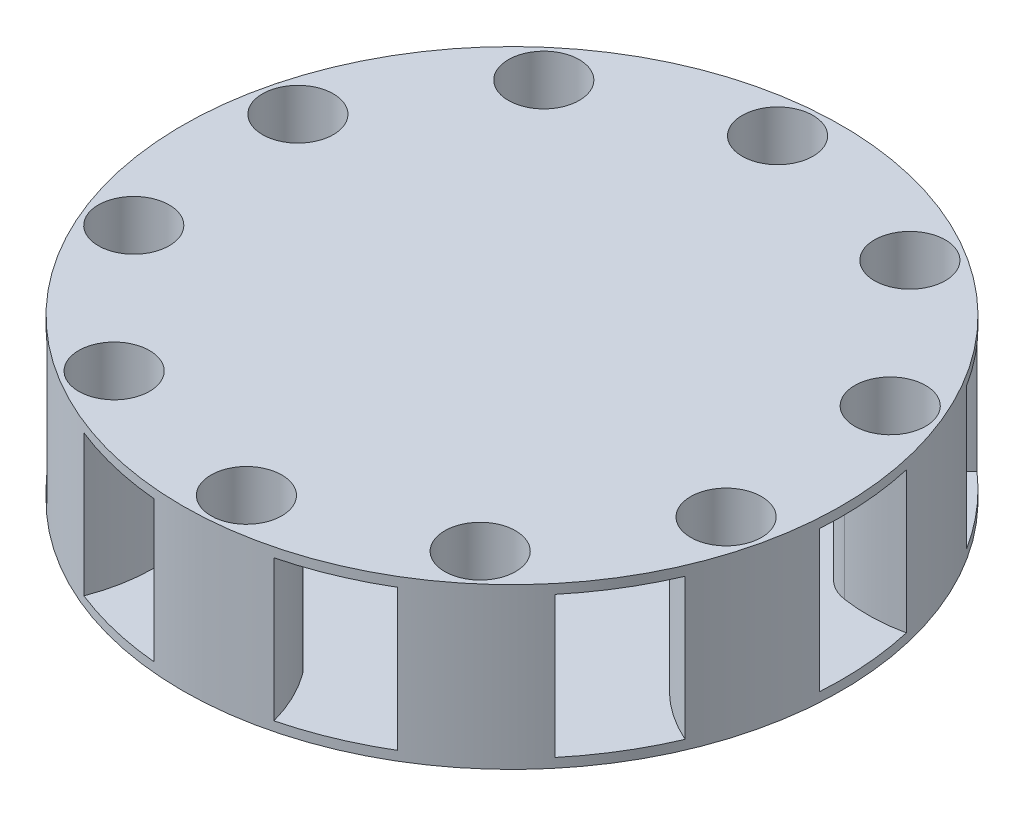
from build123d import *
from build123d.topology import SkipClean

# Parameters (mm, degrees)
SKETCH1_R           = 70
BOSS_EXTRUDE1_DEPTH = 2
SKETCH2_R           = 7.525
CUT_EXTRUDE1_DEPTH  = 2
SKETCH3_R           = 7.525
BOSS_EXTRUDE3_DEPTH = 32
SKETCH4_R           = 70
BOSS_EXTRUDE4_DEPTH = 2


with BuildPart() as part:
    # Sketch1 → Boss-Extrude1 (new body)
    with BuildSketch(Plane(origin=(0, 0, 0), x_dir=(1, 0, 0), z_dir=(0, 1, 0))):
        Circle(SKETCH1_R)
    extrude(amount=-BOSS_EXTRUDE1_DEPTH)

    # Sketch2 → Cut-Extrude1 (cut)
    with BuildSketch(Plane(origin=(0, 0, 0), x_dir=(1, 0, 0), z_dir=(0, 1, 0))):
        with Locations((-56.77852978, -23.566378191)):
            Circle(SKETCH2_R)
        with Locations((-59.786765058, 14.307982)):
            Circle(SKETCH2_R)
        with Locations((-39.958488161, 46.717179376)):
            Circle(SKETCH2_R)
        with Locations((-4.867426926, 61.28200209)):
            Circle(SKETCH2_R)
        with Locations((32.082825957, 52.439182904)):
            Circle(SKETCH2_R)
        with Locations((56.77852978, 23.566378191)):
            Circle(SKETCH2_R)
        with Locations((59.786765058, -14.307982)):
            Circle(SKETCH2_R)
        with Locations((39.958488161, -46.717179376)):
            Circle(SKETCH2_R)
        with Locations((4.867426926, -61.28200209)):
            Circle(SKETCH2_R)
        with Locations((-32.082825957, -52.439182904)):
            Circle(SKETCH2_R)
    extrude(amount=-CUT_EXTRUDE1_DEPTH, mode=Mode.SUBTRACT)

    # Sketch3 → Boss-Extrude3 (add)
    # profile 1 of 10: a face of its own
    with BuildSketch(Plane(origin=(0, 0, 0), x_dir=(1, 0, 0), z_dir=(0, 1, 0))):
        with BuildLine():
            ThreePointArc((-53.839060138, 44.73651309), (-48.521333413, 41.173599259), (-42.648435641, 38.627691904))
            ThreePointArc((-42.648435641, 38.627691904), (-34.417274471, 40.238709199), (-31.549808841, 48.120652599))
            ThreePointArc((-31.549808841, 48.120652599), (-33.15457894, 54.317206918), (-35.850120348, 60.122947957))
            ThreePointArc((-35.850120348, 60.122947957), (-45.499701851, 53.195649554), (-53.839060138, 44.73651309))
        make_face()
        with Locations((-39.958488161, 46.717179376)):
            Circle(SKETCH3_R, mode=Mode.SUBTRACT)
    # profile 2 of 10: a face of its own
    with BuildSketch(Plane(origin=(0, 0, 0), x_dir=(1, 0, 0), z_dir=(0, 1, 0))):
        with BuildLine():
            ThreePointArc((-53.80894145, 20.385913384), (-58.749470976, 24.455770937), (-64.342738745, 27.568314616))
            ThreePointArc((-64.342738745, 27.568314616), (-68.07765033, 16.292130784), (-69.852177246, 4.546793813))
            ThreePointArc((-69.852177246, 4.546793813), (-63.455817749, 4.790017318), (-57.208096848, 6.182337701))
            ThreePointArc((-57.208096848, 6.182337701), (-51.495879786, 12.323833215), (-53.80894145, 20.385913384))
        make_face()
        with Locations((-59.786765058, 14.307982)):
            Circle(SKETCH3_R, mode=Mode.SUBTRACT)
    # profile 3 of 10: a face of its own
    with BuildSketch(Plane(origin=(0, 0, 0), x_dir=(1, 0, 0), z_dir=(0, 1, 0))):
        with BuildLine():
            ThreePointArc((6.336025522, 69.712658683), (-5.542413742, 69.780238248), (-17.261251979, 67.838404905))
            ThreePointArc((-17.261251979, 67.838404905), (-15.053348893, 61.830265721), (-11.798521586, 56.318580707))
            ThreePointArc((-11.798521586, 56.318580707), (-4.192440109, 52.783765932), (2.760278407, 57.474938083))
            ThreePointArc((2.760278407, 57.474938083), (5.104235368, 63.431316031), (6.336025522, 69.712658683))
        make_face()
        with Locations((-4.867426926, 61.28200209)):
            Circle(SKETCH3_R, mode=Mode.SUBTRACT)
    # profile 4 of 10: a face of its own
    with BuildSketch(Plane(origin=(0, 0, 0), x_dir=(1, 0, 0), z_dir=(0, 1, 0))):
        with BuildLine():
            ThreePointArc((-55.514887324, -15.135551852), (-61.90406192, -14.746938322), (-68.258617871, -15.516477896))
            ThreePointArc((-68.258617871, -15.516477896), (-64.652250258, -26.834428196), (-59.184136835, -37.379646161))
            ThreePointArc((-59.184136835, -37.379646161), (-54.152336488, -33.423188431), (-49.916209492, -28.624459374))
            ThreePointArc((-49.916209492, -28.624459374), (-48.904809302, -20.298328185), (-55.514887324, -15.135551852))
        make_face()
        with Locations((-56.77852978, -23.566378191)):
            Circle(SKETCH3_R, mode=Mode.SUBTRACT)
    # profile 5 of 10: a face of its own
    with BuildSketch(Plane(origin=(0, 0, 0), x_dir=(1, 0, 0), z_dir=(0, 1, 0))):
        with BuildLine():
            ThreePointArc((46.102024996, 52.674503237), (36.531888036, 59.711147674), (25.909767747, 65.028331789))
            ThreePointArc((25.909767747, 65.028331789), (24.16450326, 58.869872212), (23.558026699, 52.497685879))
            ThreePointArc((23.558026699, 52.497685879), (27.633763879, 45.167218133), (36.016033123, 44.87575072))
            ThreePointArc((36.016033123, 44.87575072), (41.413405253, 48.316818371), (46.102024996, 52.674503237))
        make_face()
        with Locations((32.082825957, 52.439182904)):
            Circle(SKETCH3_R, mode=Mode.SUBTRACT)
    # profile 6 of 10: a face of its own
    with BuildSketch(Plane(origin=(0, 0, 0), x_dir=(1, 0, 0), z_dir=(0, 1, 0))):
        with BuildLine():
            ThreePointArc((-36.016033123, -44.87575072), (-41.413405253, -48.316818371), (-46.102024996, -52.674503237))
            ThreePointArc((-46.102024996, -52.674503237), (-36.531888036, -59.711147674), (-25.909767747, -65.028331789))
            ThreePointArc((-25.909767747, -65.028331789), (-24.16450326, -58.869872212), (-23.558026699, -52.497685878))
            ThreePointArc((-23.558026699, -52.497685878), (-27.633763879, -45.167218133), (-36.016033123, -44.87575072))
        make_face()
        with Locations((-32.082825957, -52.439182904)):
            Circle(SKETCH3_R, mode=Mode.SUBTRACT)
    # profile 7 of 10: a face of its own
    with BuildSketch(Plane(origin=(0, 0, 0), x_dir=(1, 0, 0), z_dir=(0, 1, 0))):
        with BuildLine():
            ThreePointArc((68.258617871, 15.516477896), (64.652250258, 26.834428196), (59.184136835, 37.379646161))
            ThreePointArc((59.184136835, 37.379646161), (54.152336489, 33.423188431), (49.916209492, 28.624459375))
            ThreePointArc((49.916209492, 28.624459375), (48.904809302, 20.298328185), (55.514887325, 15.135551852))
            ThreePointArc((55.514887325, 15.135551852), (61.904061921, 14.746938322), (68.258617871, 15.516477896))
        make_face()
        with Locations((56.77852978, 23.566378191)):
            Circle(SKETCH3_R, mode=Mode.SUBTRACT)
    # profile 8 of 10: a face of its own
    with BuildSketch(Plane(origin=(0, 0, 0), x_dir=(1, 0, 0), z_dir=(0, 1, 0))):
        with BuildLine():
            ThreePointArc((-2.760278408, -57.474938084), (-5.104235368, -63.431316031), (-6.336025522, -69.712658683))
            ThreePointArc((-6.336025522, -69.712658683), (5.542413742, -69.780238248), (17.261251979, -67.838404905))
            ThreePointArc((17.261251979, -67.838404905), (15.053348893, -61.830265722), (11.798521586, -56.318580708))
            ThreePointArc((11.798521586, -56.318580708), (4.192440109, -52.783765932), (-2.760278408, -57.474938084))
        make_face()
        with Locations((4.867426926, -61.28200209)):
            Circle(SKETCH3_R, mode=Mode.SUBTRACT)
    # profile 9 of 10: a face of its own
    with BuildSketch(Plane(origin=(0, 0, 0), x_dir=(1, 0, 0), z_dir=(0, 1, 0))):
        with BuildLine():
            ThreePointArc((64.342738745, -27.568314616), (68.07765033, -16.292130784), (69.852177246, -4.546793813))
            ThreePointArc((69.852177246, -4.546793813), (63.455817749, -4.790017318), (57.208096849, -6.182337701))
            ThreePointArc((57.208096849, -6.182337701), (51.495879786, -12.323833215), (53.808941451, -20.385913385))
            ThreePointArc((53.808941451, -20.385913385), (58.749470976, -24.455770937), (64.342738745, -27.568314616))
        make_face()
        with Locations((59.786765058, -14.307982)):
            Circle(SKETCH3_R, mode=Mode.SUBTRACT)
    # profile 10 of 10: a face of its own
    with BuildSketch(Plane(origin=(0, 0, 0), x_dir=(1, 0, 0), z_dir=(0, 1, 0))):
        with BuildLine():
            ThreePointArc((31.549808841, -48.1206526), (33.15457894, -54.317206918), (35.850120348, -60.122947957))
            ThreePointArc((35.850120348, -60.122947957), (45.499701851, -53.195649554), (53.839060138, -44.73651309))
            ThreePointArc((53.839060138, -44.73651309), (48.521333413, -41.173599259), (42.648435641, -38.627691905))
            ThreePointArc((42.648435641, -38.627691905), (34.417274471, -40.238709199), (31.549808841, -48.1206526))
        make_face()
        with Locations((39.958488161, -46.717179376)):
            Circle(SKETCH3_R, mode=Mode.SUBTRACT)
    extrude(amount=-BOSS_EXTRUDE3_DEPTH)

    # Sketch4 → Boss-Extrude4 (add)
    with SkipClean():  # the faces are left unmerged after this step: merging them gives an invalid solid
        with BuildSketch(Plane.XZ.offset(32)):
            Circle(SKETCH4_R)
        extrude(amount=BOSS_EXTRUDE4_DEPTH)


solid = part.part
